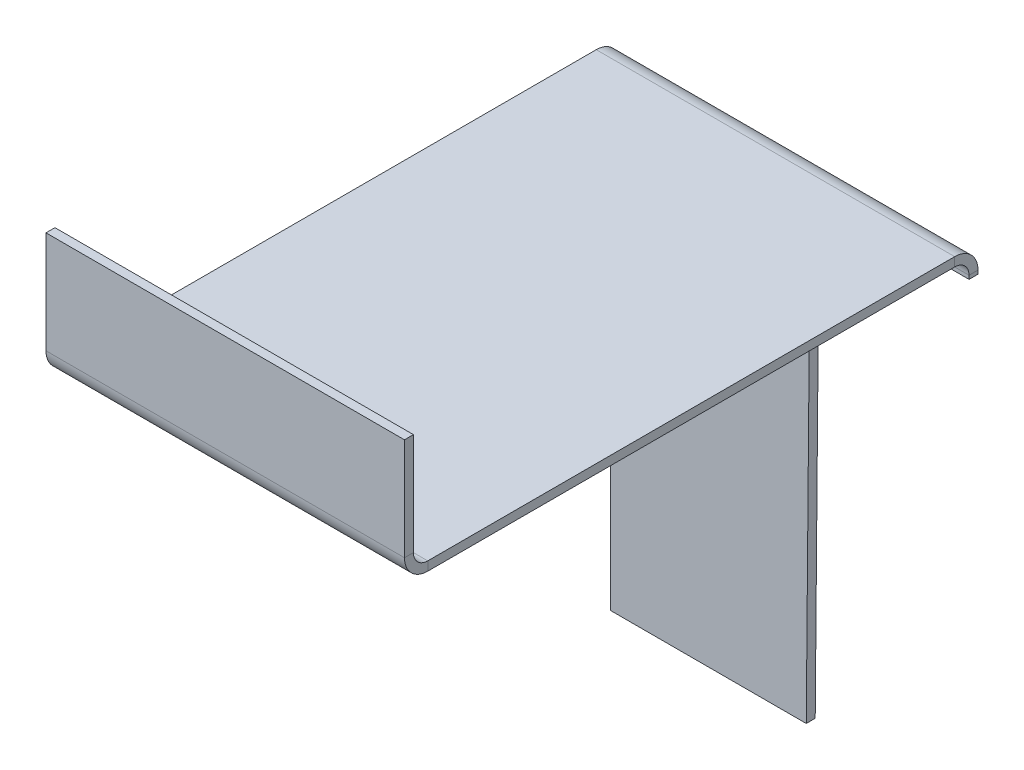
from build123d import *

# Parameters (mm, degrees)
BASE_FLANGE1_DEPTH           = 1
EDGE_FLANGE1_STRIP_W         = 7.2
EDGE_FLANGE1_STRIP_H         = 1
EDGE_FLANGE1_STRIP_CUT_DEPTH = 40
EDGE_FLANGE1_DEPTH           = 40
EDGE_FLANGE2_STRIP_W         = 7.2
EDGE_FLANGE2_STRIP_H         = 1
EDGE_FLANGE2_STRIP_CUT_DEPTH = 40
EDGE_FLANGE2_DEPTH           = 40


# Sheet-metal steps are written as plain solids
with BuildPart() as part:
    # Sketch1 → Base-Flange1 (new body)
    with BuildSketch(Plane.XY):
        Polygon((0, 0), (0, 3), (-40, 3), (-40, -52), (-18.16511543, -52), (-17.7, 0), align=None)
    extrude(amount=-BASE_FLANGE1_DEPTH)

    # Edge-Flange1 strip (across the edge) → Edge-Flange1 strip cut (cut)
    with BuildSketch(Plane(origin=(0, 3, 0), x_dir=(0, -1, 0), z_dir=(-1, 0, 0))):
        with Locations((-1, -0.5)):
            Rectangle(EDGE_FLANGE1_STRIP_W, EDGE_FLANGE1_STRIP_H)
    extrude(amount=EDGE_FLANGE1_STRIP_CUT_DEPTH, mode=Mode.SUBTRACT)

    # Edge-Flange1 section (across the edge) → Edge-Flange1 (add)
    with BuildSketch(Plane(origin=(0, 3, 0), x_dir=(0, -1, 0), z_dir=(-1, 0, 0))):
        with BuildLine():
            Line((0, 1.6), (0, 63))
            Line((0, 63), (1, 63))
            Line((1, 63), (1, 1.6))
            ThreePointArc((1, 1.6), (1.46862915, 0.46862915), (2.6, 0))
            Line((2.6, 0), (2.6, -1))
            ThreePointArc((2.6, -1), (0.761522369, -0.238477631), (0, 1.6))
        make_face()
    extrude(amount=EDGE_FLANGE1_DEPTH)

    # Edge-Flange2 strip (across the edge) → Edge-Flange2 strip cut (cut)
    with BuildSketch(Plane(origin=(-40, 3, 63), x_dir=(0, 0, -1), z_dir=(1, 0, 0))):
        with Locations((-1, -0.5)):
            Rectangle(EDGE_FLANGE2_STRIP_W, EDGE_FLANGE2_STRIP_H)
    extrude(amount=EDGE_FLANGE2_STRIP_CUT_DEPTH, mode=Mode.SUBTRACT)

    # Edge-Flange2 section (across the edge) → Edge-Flange2 (add)
    with BuildSketch(Plane(origin=(-40, 3, 63), x_dir=(0, 0, -1), z_dir=(1, 0, 0))):
        with BuildLine():
            Line((0, 1.6), (0, 13))
            Line((0, 13), (1, 13))
            Line((1, 13), (1, 1.6))
            ThreePointArc((1, 1.6), (1.46862915, 0.46862915), (2.6, 0))
            Line((2.6, 0), (2.6, -1))
            ThreePointArc((2.6, -1), (0.761522369, -0.238477631), (0, 1.6))
        make_face()
    extrude(amount=EDGE_FLANGE2_DEPTH)


solid = part.part
